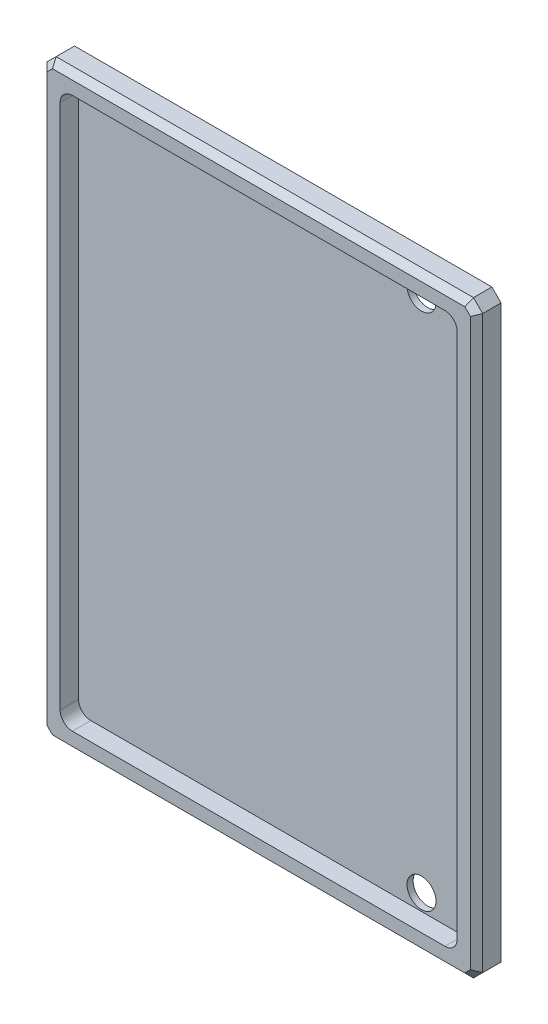
from build123d import *

# Parameters (mm, degrees)
SKETCH1_W                 = 225.425
SKETCH1_H                 = 304.8
BOSS_EXTRUDE1_DEPTH       = 12.7
CUT_EXTRUDE1_DEPTH        = 9.525
SKETCH4_R                 = 7.5
CUT_EXTRUDE3_DEPTH        = 190.976729249
M4X0_7_TAPPED_HOLE1_D     = 3.3
M4X0_7_TAPPED_HOLE1_DEPTH = 5.4
M4X0_7_TAPPED_HOLE1_TIP   = 0.991420021
CHAMFER1_SIZE             = 4.7625
CHAMFER2_SIZE             = 3.175


with BuildPart() as part:
    # Sketch1 → Boss-Extrude1 (new body)
    with BuildSketch(Plane.XY):
        Rectangle(SKETCH1_W, SKETCH1_H)
    extrude(amount=BOSS_EXTRUDE1_DEPTH)

    # Sketch2 → Cut-Extrude1 (cut)
    with BuildSketch(Plane.XY.offset(12.7)):
        with BuildLine():
            Line((96.3625, -142.4), (-96.3625, -142.4))
            ThreePointArc((-96.3625, -142.4), (-100.852628061, -140.540128061), (-102.7125, -136.05))
            Line((-102.7125, -136.05), (-102.7125, 136.05))
            ThreePointArc((-102.7125, 136.05), (-100.852628061, 140.540128061), (-96.3625, 142.4))
            Line((-96.3625, 142.4), (96.3625, 142.4))
            ThreePointArc((96.3625, 142.4), (100.852628061, 140.540128061), (102.7125, 136.05))
            Line((102.7125, 136.05), (102.7125, -136.05))
            ThreePointArc((102.7125, -136.05), (100.852628061, -140.540128061), (96.3625, -142.4))
        make_face()
    extrude(amount=-CUT_EXTRUDE1_DEPTH, mode=Mode.SUBTRACT)

    # Sketch4 → Cut-Extrude3 (cut, through all)
    with BuildSketch(Plane(origin=(0, 0, 0), x_dir=(-1, 0, 0), z_dir=(0, 0, -1))):
        with Locations((-74.7125, -134.05)):
            Circle(SKETCH4_R)
        with Locations((-74.7125, 134.05)):
            Circle(SKETCH4_R)
    extrude(amount=-CUT_EXTRUDE3_DEPTH, mode=Mode.SUBTRACT)

    # M4x0.7 Tapped Hole1
    with Locations(Plane(origin=(0, 0, 0), x_dir=(-1, 0, 0), z_dir=(0, 0, -1))):
        with Locations((107.7125, -113.6), (107.7125, 113.6)):
            Hole(M4X0_7_TAPPED_HOLE1_D / 2, depth=M4X0_7_TAPPED_HOLE1_DEPTH)
            with Locations((0, 0, -(M4X0_7_TAPPED_HOLE1_DEPTH + M4X0_7_TAPPED_HOLE1_TIP / 2))):  # 118° drill point
                Cone(0, M4X0_7_TAPPED_HOLE1_D / 2, M4X0_7_TAPPED_HOLE1_TIP, mode=Mode.SUBTRACT)

    # Chamfer1
    chamfer1_edges = [part.edges().sort_by_distance(p)[0] for p in [
        (-112.7125, 152.4, 6.35),
        (112.7125, 152.4, 6.35),
        (112.7125, -152.4, 6.35),
        (-112.7125, -152.4, 6.35),
    ]]
    chamfer(chamfer1_edges, length=CHAMFER1_SIZE)

    # Chamfer2
    chamfer2_edges = [part.edges().sort_by_distance(p)[0] for p in [
        (110.33125, -150.01875, 12.7),
        (112.7125, 0, 12.7),
        (110.33125, 150.01875, 12.7),
        (0, 152.4, 12.7),
        (-110.33125, 150.01875, 12.7),
        (-112.7125, 0, 12.7),
        (-110.33125, -150.01875, 12.7),
        (0, -152.4, 12.7),
    ]]
    chamfer(chamfer2_edges, length=CHAMFER2_SIZE)


solid = part.part
